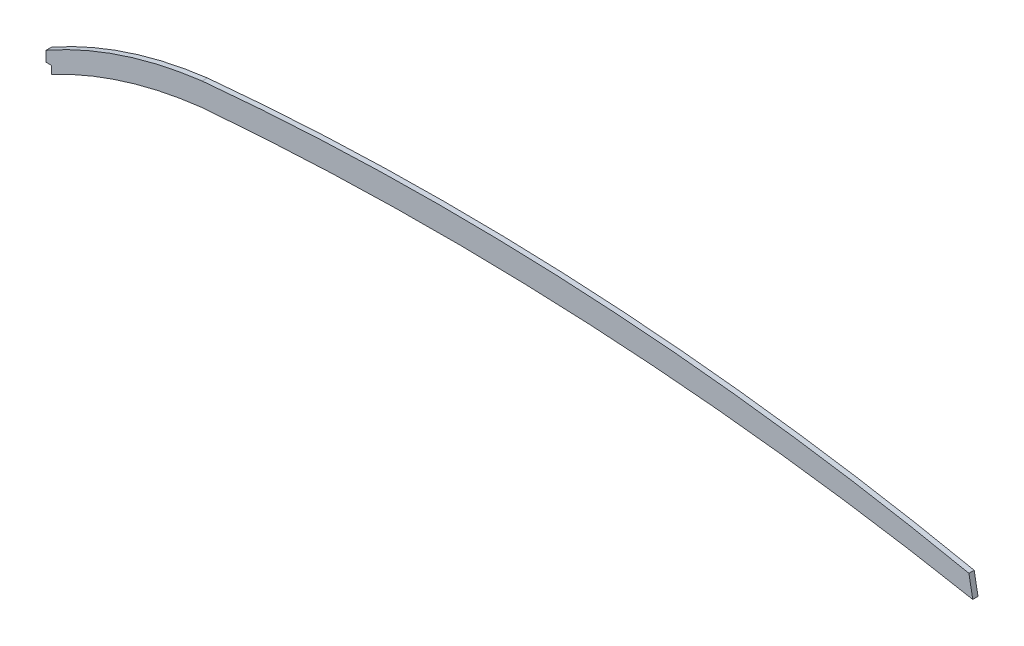
from build123d import *

# Parameters (mm, degrees)
BOSS_EXTRUDE1_DEPTH = 3.175
SKETCH2_W           = 3.3528
SKETCH2_H           = 6.477
CUT_EXTRUDE1_DEPTH  = 577.346072705


with BuildPart() as part:
    # Sketch1 → Boss-Extrude1 (new body)
    with BuildSketch(Plane.XY):
        with BuildLine():
            Line((557.916984218, 99.326538403), (555.638244479, 111.822940833))
            ThreePointArc((555.638244479, 111.822940833), (325.782502236, 142.132503557), (93.98, 137.668))
            ThreePointArc((93.98, 137.668), (45.466310815, 126.795024577), (0, 106.68))
            Line((0, 106.68), (0, 93.98))
            ThreePointArc((0, 93.98), (45.52945751, 113.491169294), (93.98, 123.794671649))
            ThreePointArc((93.98, 123.794671649), (326.784483289, 127.411721364), (557.916984218, 99.326538403))
        make_face()
    extrude(amount=BOSS_EXTRUDE1_DEPTH)

    # Sketch2 → Cut-Extrude1 (cut, through all)
    with BuildSketch(Plane.XY.offset(3.175)):
        with Locations((1.6764, 97.2185)):
            Rectangle(SKETCH2_W, SKETCH2_H)
    extrude(amount=-CUT_EXTRUDE1_DEPTH, mode=Mode.SUBTRACT)


solid = part.part
